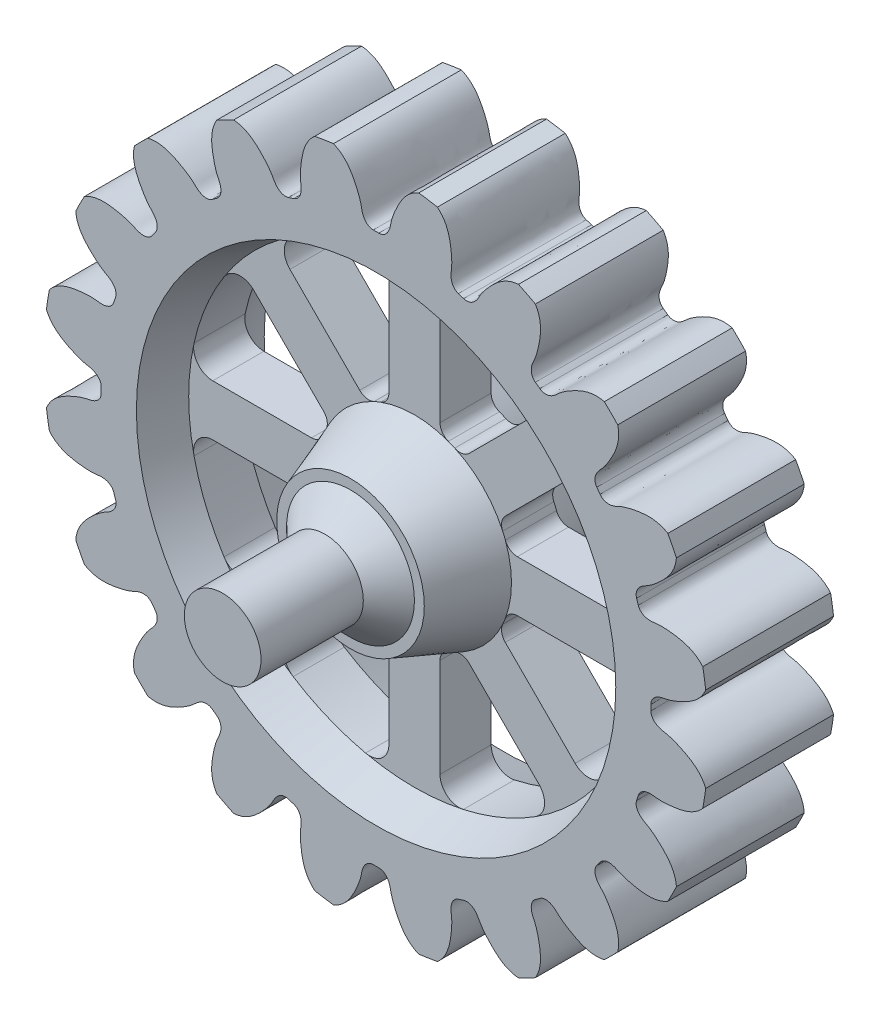
from build123d import *

# Parameters (mm, degrees)
GEAR_BASESKETCH_R         = 52
GEARMODULE_DEPTH          = 10
TOOTH_CUT_DEPTH           = 75.215901261
TOOTH_PATTERN_20_COUNT    = 20
SKETCH4_R                 = 37.5
SKETCH4_R_2               = 13
CUT_EXTRUDE2_DEPTH        = 6
CUT_EXTRUDE2_DRAFT        = -20
MIRROR1_COPY_1_SKETCH_R   = 37.5
MIRROR1_COPY_1_SKETCH_R_2 = 13
MIRROR1_COPY_1_DEPTH      = 6
MIRROR1_COPY_1_DRAFT      = -20
SKETCH5_R                 = 13
BOSS_EXTRUDE2_DEPTH       = 4
BOSS_EXTRUDE2_TAPER       = 20
CUT_EXTRUDE3_DEPTH        = 17
CUT_EXTRUDE4_DEPTH        = 17
CIRPATTERN2_COUNT         = 8
SKETCH8_R                 = 10
BOSS_EXTRUDE3_DEPTH       = 20
SKETCH9_R                 = 13.044993276
SKETCH9_R_2               = 6
CUT_EXTRUDE5_DEPTH        = 15
CHAMFER1_SIZE             = 5
SCALE1_SCALE              = 0.7


with BuildPart() as part:
    # Gear-BaseSketch → GearModule (new, symmetric)
    with BuildSketch(Plane.XY):
        Circle(GEAR_BASESKETCH_R)
    extrude(amount=GEARMODULE_DEPTH, both=True)

    # Tooth-Sketch; Backlash: 0,0000mm → Tooth-Cut (cut, symmetric)
    with BuildSketch(Plane.XY):
        with BuildLine():
            ThreePointArc((-6.851459354, 51.642607258), (0, 52.095118578), (6.851459354, 51.642607258))
            add(Edge.make_bspline(
                [(6.851459354, 51.642607258), (4.845799286, 50.902137845), (3.4055464, 48.506297893), (2.406375949, 45.895651301), (2.267501494, 45.031793567), (2.24513064, 44.91757655), (2.205147168, 44.734187514), (2.137906858, 44.486486425), (2.02487326, 44.18063283), (1.878579652, 43.887399242), (1.683916634, 43.602610252), (1.415237305, 43.330169014), (1.002762947, 43.072495649), (0.643458952, 42.998685281), (0.431329694, 42.997836628)],
                knots=[0, 0, 0, 0, 0.514021688, 0.725404565, 0.735889873, 0.746181256, 0.756292498, 0.785707009, 0.814222058, 0.842705447, 0.872477908, 0.905419945, 0.943594132, 1, 1, 1, 1], degree=3))
            ThreePointArc((0.431329694, 42.997836628), (0, 43), (-0.431329694, 42.997836628))
            add(Edge.make_bspline(
                [(-6.851459354, 51.642607258), (-4.845799286, 50.902137845), (-3.4055464, 48.506297893), (-2.406375949, 45.895651301), (-2.267501494, 45.031793567), (-2.24513064, 44.91757655), (-2.205147168, 44.734187514), (-2.137906858, 44.486486425), (-2.02487326, 44.18063283), (-1.878579652, 43.887399242), (-1.683916634, 43.602610252), (-1.415237305, 43.330169014), (-1.002762947, 43.072495649), (-0.643458952, 42.998685281), (-0.431329694, 42.997836628)],
                knots=[0, 0, 0, 0, 0.514021688, 0.725404565, 0.735889873, 0.746181256, 0.756292498, 0.785707009, 0.814222058, 0.842705447, 0.872477908, 0.905419945, 0.943594132, 1, 1, 1, 1], degree=3))
        make_face()
    tooth_cut = extrude(amount=TOOTH_CUT_DEPTH, both=True, mode=Mode.SUBTRACT)

    # Tooth Pattern 20: Tooth-Cut ×20 about axis
    tooth_pattern_20_axis = Axis((0, 0, -88.99), (0, 0, 1))
    for i in range(1, TOOTH_PATTERN_20_COUNT):
        add(tooth_cut.rotate(tooth_pattern_20_axis, i * 360 / TOOTH_PATTERN_20_COUNT), mode=Mode.SUBTRACT)


with BuildPart() as cut_extrude2_tool:
    # Sketch4 → Cut-Extrude2 (with draft: the straight prism first)
    with BuildSketch(Plane.XY.offset(10)):
        Circle(SKETCH4_R)
        Circle(SKETCH4_R_2, mode=Mode.SUBTRACT)
    extrude(amount=-CUT_EXTRUDE2_DEPTH)
    # Cut-Extrude2: the draft: its side faces are tilted about the plane it starts from
    cut_extrude2_sides = [cut_extrude2_tool.faces().sort_by_distance(p)[0] for p in [
        (-37.5, 0, 7),
        (-13, 0, 7),
    ]]
    draft(cut_extrude2_sides, Plane.XY.offset(10), CUT_EXTRUDE2_DRAFT)


with BuildPart() as part_1:
    add(part.part)

    # Cut-Extrude2: cut by cut_extrude2_tool
    add(cut_extrude2_tool.part, mode=Mode.SUBTRACT)


with BuildPart() as mirror1_copy_1_tool:
    # Mirror1 copy 1 sketch → Mirror1 copy 1 (with draft: the straight prism first)
    with BuildSketch(Plane(origin=(0, 0, -10), x_dir=(1, 0, 0), z_dir=(0, 0, -1))):
        Circle(MIRROR1_COPY_1_SKETCH_R)
        Circle(MIRROR1_COPY_1_SKETCH_R_2, mode=Mode.SUBTRACT)
    extrude(amount=-MIRROR1_COPY_1_DEPTH)
    # Mirror1 copy 1: the draft: its side faces are tilted about the plane it starts from
    mirror1_copy_1_sides = [mirror1_copy_1_tool.faces().sort_by_distance(p)[0] for p in [
        (-37.5, 0, -7),
        (-13, 0, -7),
    ]]
    draft(mirror1_copy_1_sides, Plane(origin=(0, 0, -10), x_dir=(1, 0, 0), z_dir=(0, 0, -1)), MIRROR1_COPY_1_DRAFT)


with BuildPart() as part_2:
    add(part_1.part)

    # Mirror1 copy 1: cut by mirror1_copy_1_tool
    add(mirror1_copy_1_tool.part, mode=Mode.SUBTRACT)

    # Sketch5 → Boss-Extrude2 (add)
    with BuildSketch(Plane.XY.offset(10)):
        Circle(SKETCH5_R)
    boss_extrude2 = extrude(amount=BOSS_EXTRUDE2_DEPTH, taper=BOSS_EXTRUDE2_TAPER)

    # Mirror2: Boss-Extrude2 across plane
    add(boss_extrude2.mirror(Plane.XY))

    # Sketch6 → Cut-Extrude3 (cut, symmetric)
    with BuildSketch(Plane.XY):
        with BuildLine():
            Line((-2, 8.5), (2, 8.5))
            Line((2, 8.5), (2, 6.708203932))
            ThreePointArc((2, 6.708203932), (0, -7), (-2, 6.708203932))
            Line((-2, 6.708203932), (-2, 8.5))
        make_face()
    extrude(amount=CUT_EXTRUDE3_DEPTH, both=True, mode=Mode.SUBTRACT)

    # Sketch7 → Cut-Extrude4 (cut, symmetric)
    with BuildSketch(Plane.XY):
        with BuildLine():
            Line((-8.557610775, 14.214465024), (-19.480039866, 25.136894115))
            ThreePointArc((-19.480039866, 25.136894115), (-20.340860064, 27.585074964), (-18.970177338, 29.788669696))
            ThreePointArc((-18.970177338, 29.788669696), (-13.514916443, 32.62789457), (-7.649829309, 34.477711381))
            ThreePointArc((-7.649829309, 34.477711381), (-5.12243348, 33.888753653), (-4, 31.548936574))
            Line((-4, 31.548936574), (-4, 16.102289219))
            ThreePointArc((-4, 16.102289219), (-4.357340181, 14.961382247), (-5.30166872, 14.228167179))
            ThreePointArc((-5.30166872, 14.228167179), (-5.810596892, 14.028021822), (-6.311987592, 13.809679399))
            ThreePointArc((-6.311987592, 13.809679399), (-7.498190052, 13.660399633), (-8.557610775, 14.214465024))
        make_face()
    cut_extrude4 = extrude(amount=CUT_EXTRUDE4_DEPTH, both=True, mode=Mode.SUBTRACT)

    # CirPattern2: Cut-Extrude4 ×8 about axis
    cirpattern2_axis = Axis((0, 0, 0), (0, 0, 1))
    for i in range(1, CIRPATTERN2_COUNT):
        add(cut_extrude4.rotate(cirpattern2_axis, i * 360 / CIRPATTERN2_COUNT), mode=Mode.SUBTRACT)

    # Sketch8 → Boss-Extrude3 (add)
    with BuildSketch(Plane.XY.offset(14)):
        Circle(SKETCH8_R)
    extrude(amount=BOSS_EXTRUDE3_DEPTH)

    # Sketch9 → Cut-Extrude5 (cut)
    with BuildSketch(Plane.XY.offset(34)):
        Circle(SKETCH9_R)
        Circle(SKETCH9_R_2, mode=Mode.SUBTRACT)
    extrude(amount=-CUT_EXTRUDE5_DEPTH, mode=Mode.SUBTRACT)

    # Chamfer1
    # the kernel refuses this chamfer: 5 mm, written as the material it takes off along each edge
    with BuildSketch(Plane(origin=(0, 0, 19), x_dir=(1, 0, 0), z_dir=(0, 1, 0))) as chamfer1_piece_1_section:
        Polygon((10, CHAMFER1_SIZE), (10 - CHAMFER1_SIZE, 0), (10, 0), align=None)
    chamfer1_piece_1 = revolve(axis=Axis((0, 0, 19), (0, 0, -1)), mode=Mode.PRIVATE)
    chamfer1_piece_1 = split(chamfer1_piece_1, bisect_by=Plane(origin=(-8.062637377, 0, 14), z_dir=(0, 0, 1)), keep=Keep.TOP, mode=Mode.PRIVATE)
    chamfer1_piece_1 = chamfer1_piece_1 - Plane(origin=(0, 0, 16.062637377), x_dir=(1, 0, 0), z_dir=(0, 0, 1)) * Cylinder(6, 40, mode=Mode.PRIVATE)
    add(chamfer1_piece_1, mode=Mode.SUBTRACT)


with BuildPart() as part_3:
    # Scale1: scaled about (-2.4963e-05, -0.015187767, 0.660734745)
    add(part_2.part.scale(SCALE1_SCALE).moved(Location((-7.489e-06, -0.00455633, 0.198220424))))


solid = part_3.part
